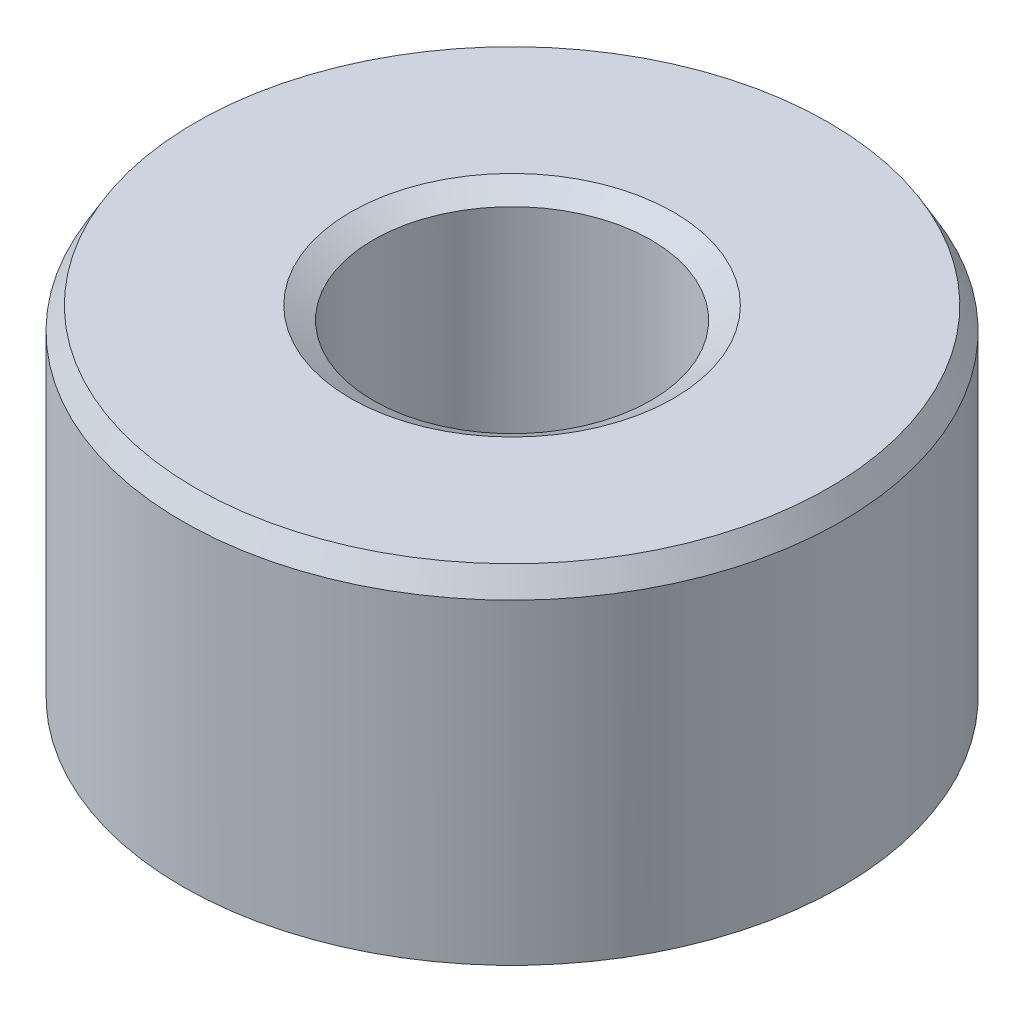
from build123d import *
from OCP.BRepFilletAPI import BRepFilletAPI_MakeChamfer

# Parameters (mm, degrees)
SKETCH1_R           = 57.5
BOSS_EXTRUDE1_DEPTH = 61.351404532
SKETCH2_R           = 24.254112411
CUT_EXTRUDE1_DEPTH  = 102.865081545
CHAMFER1_SIZE       = 3.913945126
CHAMFER1_SIZE2      = 2.259717272


with BuildPart() as part:
    # Sketch1 → Boss-Extrude1 (new body)
    with BuildSketch(Plane(origin=(0, 0, 0), x_dir=(1, 0, 0), z_dir=(0, 1, 0))):
        Circle(SKETCH1_R)
    extrude(amount=BOSS_EXTRUDE1_DEPTH)

    # Sketch2 → Cut-Extrude1 (cut, through all)
    with BuildSketch(Plane(origin=(0, 0, 0), x_dir=(1, 0, 0), z_dir=(0, 1, 0))):
        Circle(SKETCH2_R)
    extrude(amount=CUT_EXTRUDE1_DEPTH, mode=Mode.SUBTRACT)

    # Chamfer1: one chamfer whose edges measure the first distance from different faces: ONE call of the kernel's chamfer builder (chamfer() names one face for all edges)
    chamfer1_edges_1 = [part.edges().sort_by_distance(p)[0] for p in [
        (-24.254112411, 61.351404532, 0),
    ]]
    chamfer1_side_1 = [part.faces().sort_by_distance(p)[0] for p in [
        (-55.873654403, 61.351404532, 0),
    ]]
    chamfer1_edges_2 = [part.edges().sort_by_distance(p)[0] for p in [
        (-24.254112411, 0, 0),
    ]]
    chamfer1_side_2 = [part.faces().sort_by_distance(p)[0] for p in [
        (-24.254112411, 30.675702266, 0),
    ]]
    chamfer1_edges_3 = [part.edges().sort_by_distance(p)[0] for p in [
        (-57.5, 0, 0),
    ]]
    chamfer1_side_3 = [part.faces().sort_by_distance(p)[0] for p in [
        (-55.873654403, 0, 0),
    ]]
    chamfer1_edges_4 = [part.edges().sort_by_distance(p)[0] for p in [
        (-57.5, 61.351404532, 0),
    ]]
    chamfer1_side_4 = [part.faces().sort_by_distance(p)[0] for p in [
        (-57.5, 30.675702266, 0),
    ]]
    chamfer1 = BRepFilletAPI_MakeChamfer(part.part.solid().wrapped)
    for e in chamfer1_edges_1:
        chamfer1.Add(CHAMFER1_SIZE, CHAMFER1_SIZE2, e.wrapped, chamfer1_side_1[0].wrapped)  # the first distance lies on this face
    for e in chamfer1_edges_2:
        chamfer1.Add(CHAMFER1_SIZE, CHAMFER1_SIZE2, e.wrapped, chamfer1_side_2[0].wrapped)  # the first distance lies on this face
    for e in chamfer1_edges_3:
        chamfer1.Add(CHAMFER1_SIZE, CHAMFER1_SIZE2, e.wrapped, chamfer1_side_3[0].wrapped)  # the first distance lies on this face
    for e in chamfer1_edges_4:
        chamfer1.Add(CHAMFER1_SIZE, CHAMFER1_SIZE2, e.wrapped, chamfer1_side_4[0].wrapped)  # the first distance lies on this face
    add(Compound.cast(chamfer1.Shape()), mode=Mode.REPLACE)


solid = part.part
